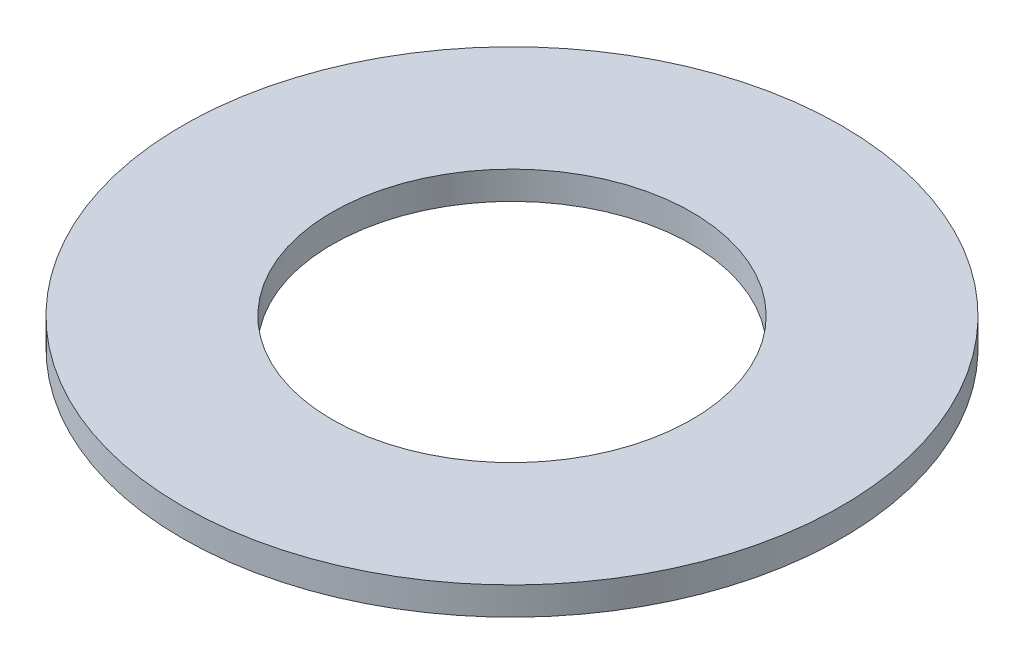
from build123d import *

# Parameters (mm, degrees)
SKETCH1_R           = 82.5
BOSS_EXTRUDE1_DEPTH = 7
SKETCH2_R           = 45
CUT_EXTRUDE1_DEPTH  = 117.882419551


with BuildPart() as part:
    # Sketch1 → Boss-Extrude1 (new body)
    with BuildSketch(Plane(origin=(0, 0, 0), x_dir=(1, 0, 0), z_dir=(0, 1, 0))):
        Circle(SKETCH1_R)
    extrude(amount=BOSS_EXTRUDE1_DEPTH)

    # Sketch2 → Cut-Extrude1 (cut, through all)
    with BuildSketch(Plane(origin=(0, 0, 0), x_dir=(1, 0, 0), z_dir=(0, 1, 0))):
        Circle(SKETCH2_R)
    extrude(amount=CUT_EXTRUDE1_DEPTH, mode=Mode.SUBTRACT)


solid = part.part
